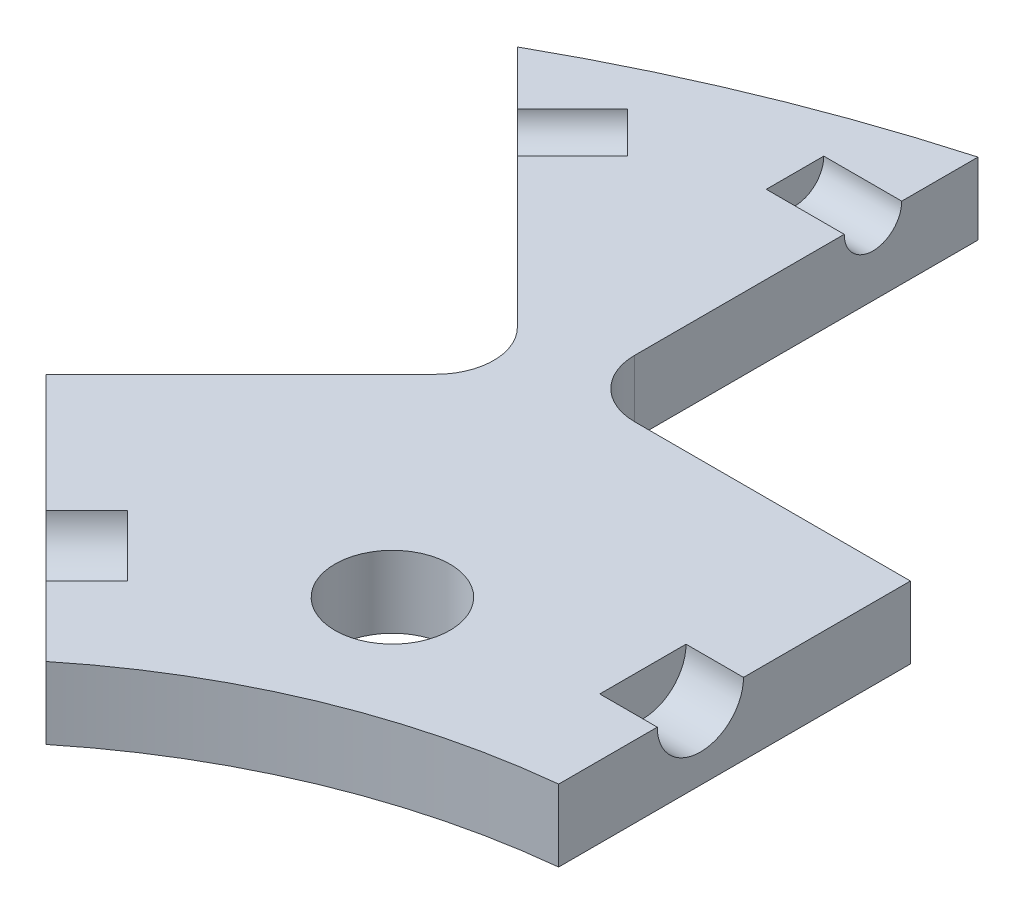
from build123d import *

# Parameters (mm, degrees)
SKETCH1_R                   = 82.55
BASE_EXTRUDE_DEPTH          = 3.96875
WHEEL_SHAPE_CUT_DEPTH       = 117.810769951
RELIEF_FILLET_R             = 3.175
TOLERANCE_CUT_DEPTH         = 117.810769951
CUT_START                   = -3.96875
CUT_PATTERN_DEPTH           = 7.9375
SKETCH3_R                   = 1.5875
WHEEL_AXLE_CUT_DEPTH        = 26.6827
WHEEL_AXLE_PATTERN_COUNT    = 8
SKETCH5_R                   = 82.55
SHELL_CUT_DEPTH             = 113.442536881
SKETCH7_W                   = 7.9375
SKETCH7_H                   = 63.330582695
IDLER_CUT_DEPTH             = 113.442536881
SKETCH9_R                   = 2.38125
IDLER_AXLE_CUT_DEPTH        = 7.14375
IDLER_PATTERN_COUNT         = 8
MAIN_GEAR_CUT_DEPTH         = 113.442536881
MAIN_GEAR_CUT_DEPTH_BACK    = 113.442536881
SKETCH8_R                   = 38.1
SCREW_ACCESS_CUT_DEPTH      = 113.442536881
SCREW_ACCESS_CUT_DEPTH_BACK = 113.442536881
SKETCH17_R                  = 3.175


# Read off the part's stored shape, not the designer's step: Cut Pattern
with BuildPart() as part:
    # Sketch1 → Base Extrude (new, symmetric)
    with BuildSketch(Plane(origin=(0, 0, 0), x_dir=(1, 0, 0), z_dir=(0, 1, 0))):
        with Locations(Location((0, 0, 0), (0, 0, 270))):
            Circle(SKETCH1_R)
    extrude(amount=BASE_EXTRUDE_DEPTH, both=True)

    # Sketch2 → Wheel Shape Cut (cut, symmetric)
    with BuildSketch(Plane(origin=(0, 0, 0), x_dir=(1, 0, 0), z_dir=(0, 1, 0))):
        with BuildLine():
            Line((-21.919482915, 86.15536123), (-21.919482915, 61.16463877))
            ThreePointArc((-21.919482915, 61.16463877), (0, 58.42), (21.919482915, 61.16463877))
            Line((21.919482915, 61.16463877), (21.919482915, 86.15536123))
            ThreePointArc((21.919482915, 86.15536123), (0, 88.9), (-21.919482915, 86.15536123))
        make_face()
    extrude(amount=WHEEL_SHAPE_CUT_DEPTH, both=True, mode=Mode.SUBTRACT)

    # Relief Fillet
    relief_fillet_edges = [part.edges().sort_by_distance(p)[0] for p in [
        (-21.919482915, 0, -61.16463877),
        (21.919482915, 0, -61.16463877),
    ]]
    fillet(relief_fillet_edges, radius=RELIEF_FILLET_R)

    # Sketch16 → Tolerance Cut (cut, symmetric)
    with BuildSketch(Plane(origin=(0, 0, 0), x_dir=(1, 0, 0), z_dir=(0, 1, 0))):
        with BuildLine():
            Line((19.201682915, 57.319417305), (-19.201682915, 57.319417305))
            ThreePointArc((-19.201682915, 57.319417305), (-21.446746945, 58.249353274), (-22.376682915, 60.494417305))
            Line((-22.376682915, 60.494417305), (-22.376682915, 79.459339047))
            ThreePointArc((-22.376682915, 79.459339047), (-22.148174425, 79.523335378), (-21.919482915, 79.586674568))
            Line((-21.919482915, 79.586674568), (-21.919482915, 63.669417305))
            ThreePointArc((-21.919482915, 63.669417305), (-21.222873253, 61.684925851), (-19.438723023, 60.571247575))
            ThreePointArc((-19.438723023, 60.571247575), (0, 58.42), (19.438723023, 60.571247575))
            ThreePointArc((19.438723023, 60.571247575), (21.222873253, 61.684925851), (21.919482915, 63.669417305))
            Line((21.919482915, 63.669417305), (21.919482915, 79.586674568))
            ThreePointArc((21.919482915, 79.586674568), (22.148174425, 79.523335378), (22.376682915, 79.459339047))
            Line((22.376682915, 79.459339047), (22.376682915, 60.494417305))
            ThreePointArc((22.376682915, 60.494417305), (21.446746945, 58.249353274), (19.201682915, 57.319417305))
        make_face()
    extrude(amount=TOLERANCE_CUT_DEPTH, both=True, mode=Mode.SUBTRACT)

    # Cut Pattern outline → Cut Pattern (cut)
    with BuildSketch(Plane(origin=(0, 0, 0), x_dir=(1, 0, 0), z_dir=(0, 1, 0)).offset(CUT_START)):
        with BuildLine():
            ThreePointArc((-19.201682915, -57.319417305), (-21.446746945, -58.249353275), (-22.376682915, -60.494417305))
            Line((-22.376682915, -60.494417305), (-22.376682915, -79.459339047))
            ThreePointArc((-22.376682915, -79.459339047), (0, -82.55), (22.376682915, -79.459339047))
            Line((22.376682915, -79.459339047), (22.376682915, -60.494417305))
            ThreePointArc((22.376682915, -60.494417305), (21.446746945, -58.249353275), (19.201682915, -57.319417305))
            Line((19.201682915, -57.319417305), (-19.201682915, -57.319417305))
        make_face()
        with BuildLine():
            Line((58.598716929, 26.953308471), (72.008941698, 40.363533239))
            ThreePointArc((72.008941698, 40.363533239), (58.371664787, 58.371664787), (40.363533239, 72.008941698))
            Line((40.363533239, 72.008941698), (26.953308471, 58.598716929))
            ThreePointArc((26.953308471, 58.598716929), (26.023372501, 56.353652899), (26.953308471, 54.108588869))
            Line((26.953308471, 54.108588869), (54.108588869, 26.953308471))
            ThreePointArc((54.108588869, 26.953308471), (56.353652899, 26.023372501), (58.598716929, 26.953308471))
        make_face()
        with BuildLine():
            Line((60.494417305, -22.376682915), (79.459339047, -22.376682915))
            ThreePointArc((79.459339047, -22.376682915), (82.55, 0), (79.459339047, 22.376682915))
            Line((79.459339047, 22.376682915), (60.494417305, 22.376682915))
            ThreePointArc((60.494417305, 22.376682915), (58.249353275, 21.446746945), (57.319417305, 19.201682915))
            Line((57.319417305, 19.201682915), (57.319417305, -19.201682915))
            ThreePointArc((57.319417305, -19.201682915), (58.249353275, -21.446746945), (60.494417305, -22.376682915))
        make_face()
        with BuildLine():
            Line((26.953308471, -58.598716929), (40.363533239, -72.008941698))
            ThreePointArc((40.363533239, -72.008941698), (58.371664787, -58.371664787), (72.008941698, -40.363533239))
            Line((72.008941698, -40.363533239), (58.598716929, -26.953308471))
            ThreePointArc((58.598716929, -26.953308471), (56.353652899, -26.023372501), (54.108588869, -26.953308471))
            Line((54.108588869, -26.953308471), (26.953308471, -54.108588869))
            ThreePointArc((26.953308471, -54.108588869), (26.023372501, -56.353652899), (26.953308471, -58.598716929))
        make_face()
        with BuildLine():
            ThreePointArc((-40.363533239, 72.008941698), (-58.371664787, 58.371664787), (-72.008941698, 40.363533239))
            Line((-72.008941698, 40.363533239), (-58.598716929, 26.953308471))
            ThreePointArc((-58.598716929, 26.953308471), (-56.353652899, 26.023372501), (-54.108588869, 26.953308471))
            Line((-54.108588869, 26.953308471), (-26.953308471, 54.108588869))
            ThreePointArc((-26.953308471, 54.108588869), (-26.023372501, 56.353652899), (-26.953308471, 58.598716929))
            Line((-26.953308471, 58.598716929), (-40.363533239, 72.008941698))
        make_face()
        with BuildLine():
            ThreePointArc((-79.459339047, 22.376682915), (-82.55, 0), (-79.459339047, -22.376682915))
            Line((-79.459339047, -22.376682915), (-60.494417305, -22.376682915))
            ThreePointArc((-60.494417305, -22.376682915), (-58.249353275, -21.446746945), (-57.319417305, -19.201682915))
            Line((-57.319417305, -19.201682915), (-57.319417305, 19.201682915))
            ThreePointArc((-57.319417305, 19.201682915), (-58.249353275, 21.446746945), (-60.494417305, 22.376682915))
            Line((-60.494417305, 22.376682915), (-79.459339047, 22.376682915))
        make_face()
        with BuildLine():
            ThreePointArc((-72.008941698, -40.363533239), (-58.371664787, -58.371664787), (-40.363533239, -72.008941698))
            Line((-40.363533239, -72.008941698), (-26.953308471, -58.598716929))
            ThreePointArc((-26.953308471, -58.598716929), (-26.023372501, -56.353652899), (-26.953308471, -54.108588869))
            Line((-26.953308471, -54.108588869), (-54.108588869, -26.953308471))
            ThreePointArc((-54.108588869, -26.953308471), (-56.353652899, -26.023372501), (-58.598716929, -26.953308471))
            Line((-58.598716929, -26.953308471), (-72.008941698, -40.363533239))
        make_face()
    extrude(amount=CUT_PATTERN_DEPTH, mode=Mode.SUBTRACT)

    # Sketch3 → Wheel Axle Cut (cut, symmetric)
    with BuildSketch(Plane(origin=(0, 0, 0), x_dir=(0, 0, -1), z_dir=(1, 0, 0))):
        with Locations((73.66, 0)):
            Circle(SKETCH3_R)
    wheel_axle_cut = extrude(amount=WHEEL_AXLE_CUT_DEPTH, both=True, mode=Mode.SUBTRACT)

    # Wheel Axle Pattern: Wheel Axle Cut ×8 about axis
    wheel_axle_pattern_axis = Axis((0, 0, 0), (0, 1, 0))
    for i in range(1, WHEEL_AXLE_PATTERN_COUNT):
        add(wheel_axle_cut.rotate(wheel_axle_pattern_axis, i * 360 / WHEEL_AXLE_PATTERN_COUNT), mode=Mode.SUBTRACT)

    # Sketch5 → Shell Cut (cut, through all)
    with BuildSketch(Plane(origin=(0, 0, 0), x_dir=(1, 0, 0), z_dir=(0, 1, 0))):
        Circle(SKETCH5_R)
    extrude(amount=SHELL_CUT_DEPTH, mode=Mode.SUBTRACT)

    # Sketch7 → Idler Cut (cut, symmetric)
    with BuildSketch(Plane(origin=(0, 0, 0), x_dir=(1, 0, 0), z_dir=(0, 1, 0))):
        with Locations((0, 57.234708653)):
            Rectangle(SKETCH7_W, SKETCH7_H)
    idler_cut = extrude(amount=IDLER_CUT_DEPTH, both=True, mode=Mode.SUBTRACT)

    # Sketch9 → Idler Axle Cut (cut, symmetric)
    with BuildSketch(Plane(origin=(0, 0, 0), x_dir=(0, 0, -1), z_dir=(1, 0, 0))):
        with Locations((45.72, 0)):
            Circle(SKETCH9_R)
    idler_axle_cut = extrude(amount=IDLER_AXLE_CUT_DEPTH, both=True, mode=Mode.SUBTRACT)

    # Idler Pattern: Idler Cut, Idler Axle Cut ×8 about axis
    idler_pattern_axis = Axis((0, 0, 0), (0, 1, 0))
    add([idler_cut.rotate(idler_pattern_axis, i * 360 / IDLER_PATTERN_COUNT) for i in range(1, IDLER_PATTERN_COUNT)], mode=Mode.SUBTRACT)
    add([idler_axle_cut.rotate(idler_pattern_axis, i * 360 / IDLER_PATTERN_COUNT) for i in range(1, IDLER_PATTERN_COUNT)], mode=Mode.SUBTRACT)

    # Sketch8 → Main Gear Cut (cut, two sides: drawn at the far end of the back side and taken through both)
    with BuildSketch(Plane(origin=(0, 0, 0), x_dir=(1, 0, 0), z_dir=(0, 1, 0)).offset(-MAIN_GEAR_CUT_DEPTH_BACK)):
        Circle(SKETCH8_R)
    extrude(amount=MAIN_GEAR_CUT_DEPTH + MAIN_GEAR_CUT_DEPTH_BACK, mode=Mode.SUBTRACT)


with BuildPart() as main_gear_cut_piece_1:
    # of the separate pieces the step leaves, piece 1, a body of its own (main_gear_cut_pieces)
    add(part.part.solids().sort_by_distance((-3.96875, 0, 43.33875))[0])


with BuildPart() as main_gear_cut_piece_2:
    # of the separate pieces the step leaves, piece 2, a body of its own (main_gear_cut_pieces)
    add(part.part.solids().sort_by_distance((79.459339047, 0, -22.376682915))[0])


with BuildPart() as main_gear_cut_piece_3:
    # of the separate pieces the step leaves, piece 3, a body of its own (main_gear_cut_pieces)
    add(part.part.solids().sort_by_distance((43.33875, 0, 3.96875))[0])


with BuildPart() as main_gear_cut_piece_4:
    # of the separate pieces the step leaves, piece 4, a body of its own (main_gear_cut_pieces)
    add(part.part.solids().sort_by_distance((-22.376682915, 0, -60.494417305))[0])


with BuildPart() as main_gear_cut_piece_5:
    # of the separate pieces the step leaves, piece 5, a body of its own (main_gear_cut_pieces)
    add(part.part.solids().sort_by_distance((23.987876644, 0, -29.60053672))[0])


with BuildPart() as main_gear_cut_piece_6:
    # of the separate pieces the step leaves, piece 6, a body of its own (main_gear_cut_pieces)
    add(part.part.solids().sort_by_distance((-29.60053672, 0, -23.987876644))[0])


with BuildPart() as main_gear_cut_piece_7:
    # of the separate pieces the step leaves, piece 7, a body of its own (main_gear_cut_pieces)
    add(part.part.solids().sort_by_distance((-33.451454051, 0, 27.838793975))[0])


with BuildPart() as main_gear_cut_piece_8:
    # of the separate pieces the step leaves, piece 8, a body of its own (main_gear_cut_pieces)
    add(part.part.solids().sort_by_distance((27.838793975, 0, 33.451454051))[0])


with BuildPart() as screw_access_cut_tool:
    # Sketch17 → Screw Access Cut (new, two sides: drawn at the far end of the back side and taken through both)
    with BuildSketch(Plane(origin=(0, 0, 0), x_dir=(1, 0, 0), z_dir=(0, 1, 0)).offset(-SCREW_ACCESS_CUT_DEPTH_BACK)):
        with Locations(Location((-17.496286528, 42.239772226, 0), (0, 0, 270))):
            Circle(SKETCH17_R)
        with Locations(Location((17.496286528, 42.239772226, 0), (0, 0, 270))):
            Circle(SKETCH17_R)
        with Locations(Location((42.239772226, 17.496286528, 0), (0, 0, 270))):
            Circle(SKETCH17_R)
        with Locations(Location((42.239772226, -17.496286528, 0), (0, 0, 270))):
            Circle(SKETCH17_R)
        with Locations(Location((17.496286528, -42.239772226, 0), (0, 0, 270))):
            Circle(SKETCH17_R)
        with Locations(Location((-17.496286528, -42.239772226, 0), (0, 0, 270))):
            Circle(SKETCH17_R)
        with Locations(Location((-42.239772226, -17.496286528, 0), (0, 0, 270))):
            Circle(SKETCH17_R)
        with Locations(Location((-42.239772226, 17.496286528, 0), (0, 0, 270))):
            Circle(SKETCH17_R)
    extrude(amount=SCREW_ACCESS_CUT_DEPTH + SCREW_ACCESS_CUT_DEPTH_BACK)


with BuildPart() as main_gear_cut_piece_1_1:
    add(main_gear_cut_piece_1.part)

    # Screw Access Cut: cut by screw_access_cut_tool
    add(screw_access_cut_tool.part, mode=Mode.SUBTRACT)


with BuildPart() as main_gear_cut_piece_2_1:
    add(main_gear_cut_piece_2.part)

    # Screw Access Cut: cut by screw_access_cut_tool
    add(screw_access_cut_tool.part, mode=Mode.SUBTRACT)


with BuildPart() as main_gear_cut_piece_3_1:
    add(main_gear_cut_piece_3.part)

    # Screw Access Cut: cut by screw_access_cut_tool
    add(screw_access_cut_tool.part, mode=Mode.SUBTRACT)


with BuildPart() as main_gear_cut_piece_4_1:
    add(main_gear_cut_piece_4.part)

    # Screw Access Cut: cut by screw_access_cut_tool
    add(screw_access_cut_tool.part, mode=Mode.SUBTRACT)


with BuildPart() as main_gear_cut_piece_5_1:
    add(main_gear_cut_piece_5.part)

    # Screw Access Cut: cut by screw_access_cut_tool
    add(screw_access_cut_tool.part, mode=Mode.SUBTRACT)


with BuildPart() as main_gear_cut_piece_6_1:
    add(main_gear_cut_piece_6.part)

    # Screw Access Cut: cut by screw_access_cut_tool
    add(screw_access_cut_tool.part, mode=Mode.SUBTRACT)


with BuildPart() as main_gear_cut_piece_7_1:
    add(main_gear_cut_piece_7.part)

    # Screw Access Cut: cut by screw_access_cut_tool
    add(screw_access_cut_tool.part, mode=Mode.SUBTRACT)


with BuildPart() as main_gear_cut_piece_8_1:
    add(main_gear_cut_piece_8.part)

    # Screw Access Cut: cut by screw_access_cut_tool
    add(screw_access_cut_tool.part, mode=Mode.SUBTRACT)


solid = main_gear_cut_piece_4_1.part
